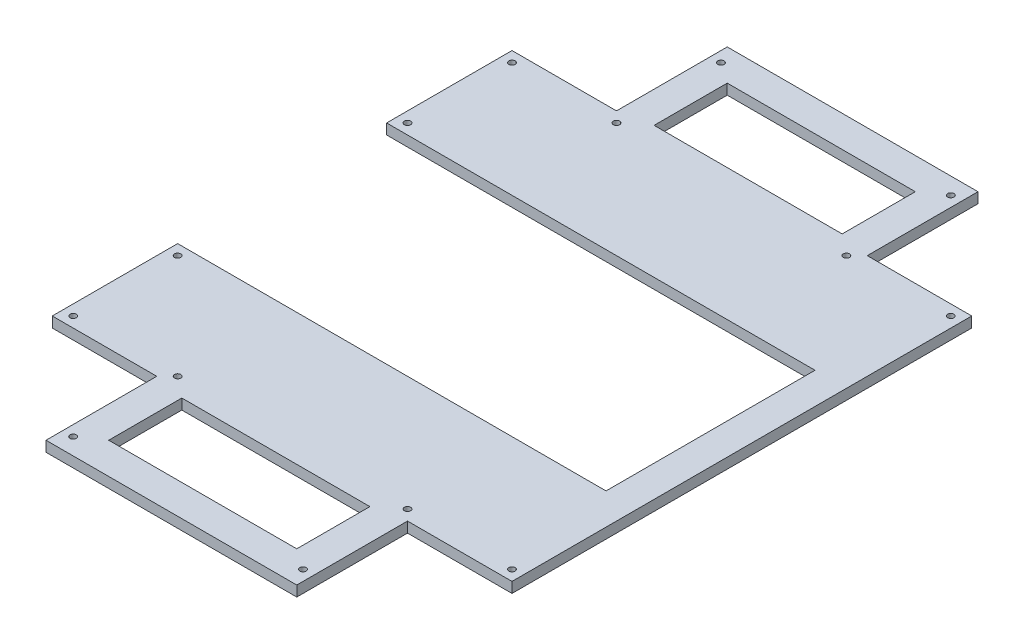
from build123d import *

# Parameters (mm, degrees)
ESQUISSE1_R        = 1.5
ESQUISSE1_W        = 90
ESQUISSE1_H        = 35
BOSS_EXTRU_1_DEPTH = 5


with BuildPart() as part:
    # Esquisse1 → Boss.-Extru.1 (new body)
    with BuildSketch(Plane(origin=(0, 0, 0), x_dir=(1, 0, 0), z_dir=(0, 1, 0))):
        Polygon((-60, 110), (-60, 163), (60, 163), (60, 110), (110, 110), (110, -110), (60, -110), (60, -163), (-60, -163), (-60, -110), (-110, -110), (-110, -50), (95, -50), (95, 50), (-110, 50), (-110, 110), align=None)
        with Locations((-105, -105)):
            Circle(ESQUISSE1_R, mode=Mode.SUBTRACT)
        with Locations((-105, -55)):
            Circle(ESQUISSE1_R, mode=Mode.SUBTRACT)
        with Locations((-55, -105)):
            Circle(ESQUISSE1_R, mode=Mode.SUBTRACT)
        with Locations((-55, -155)):
            Circle(ESQUISSE1_R, mode=Mode.SUBTRACT)
        with Locations((-55, 105)):
            Circle(ESQUISSE1_R, mode=Mode.SUBTRACT)
        with Locations((-105, 105)):
            Circle(ESQUISSE1_R, mode=Mode.SUBTRACT)
        with Locations((-105, 55)):
            Circle(ESQUISSE1_R, mode=Mode.SUBTRACT)
        with Locations((55, -155)):
            Circle(ESQUISSE1_R, mode=Mode.SUBTRACT)
        with Locations((55, -105)):
            Circle(ESQUISSE1_R, mode=Mode.SUBTRACT)
        with Locations((105, -105)):
            Circle(ESQUISSE1_R, mode=Mode.SUBTRACT)
        with Locations((105, 105)):
            Circle(ESQUISSE1_R, mode=Mode.SUBTRACT)
        with Locations((55, 105)):
            Circle(ESQUISSE1_R, mode=Mode.SUBTRACT)
        with Locations((-55, 155)):
            Circle(ESQUISSE1_R, mode=Mode.SUBTRACT)
        with Locations((55, 155)):
            Circle(ESQUISSE1_R, mode=Mode.SUBTRACT)
        with Locations((0, -130.5)):
            Rectangle(ESQUISSE1_W, ESQUISSE1_H, mode=Mode.SUBTRACT)
        with Locations((0, 130.5)):
            Rectangle(ESQUISSE1_W, ESQUISSE1_H, mode=Mode.SUBTRACT)
    extrude(amount=BOSS_EXTRU_1_DEPTH)


solid = part.part
